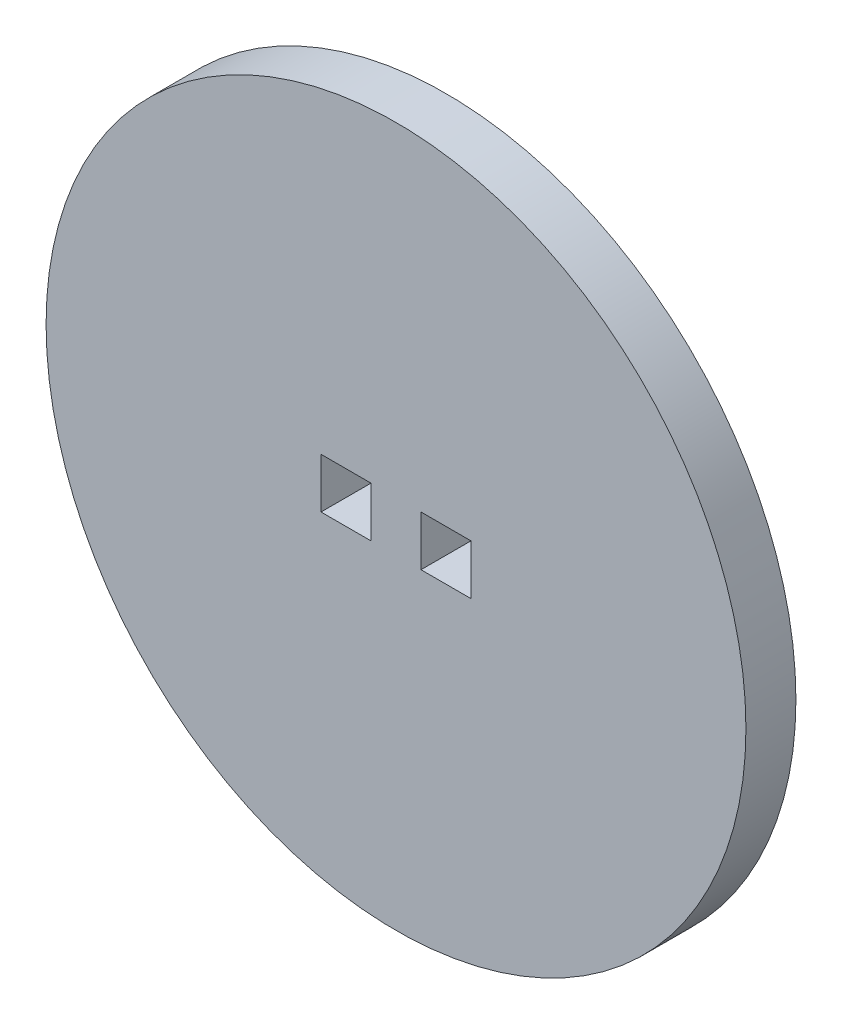
from build123d import *

# Parameters (mm, degrees)
SKETCH1_R           = 22.225
SKETCH1_W           = 3.175
SKETCH1_H           = 3.175
BOSS_EXTRUDE1_DEPTH = 3.175


with BuildPart() as part:
    # Sketch1 → Boss-Extrude1 (new body)
    with BuildSketch(Plane.XY):
        Circle(SKETCH1_R)
        with Locations((3.175, 0)):
            Rectangle(SKETCH1_W, SKETCH1_H, mode=Mode.SUBTRACT)
        with Locations((-3.175, 0)):
            Rectangle(SKETCH1_W, SKETCH1_H, mode=Mode.SUBTRACT)
    extrude(amount=BOSS_EXTRUDE1_DEPTH)


solid = part.part
